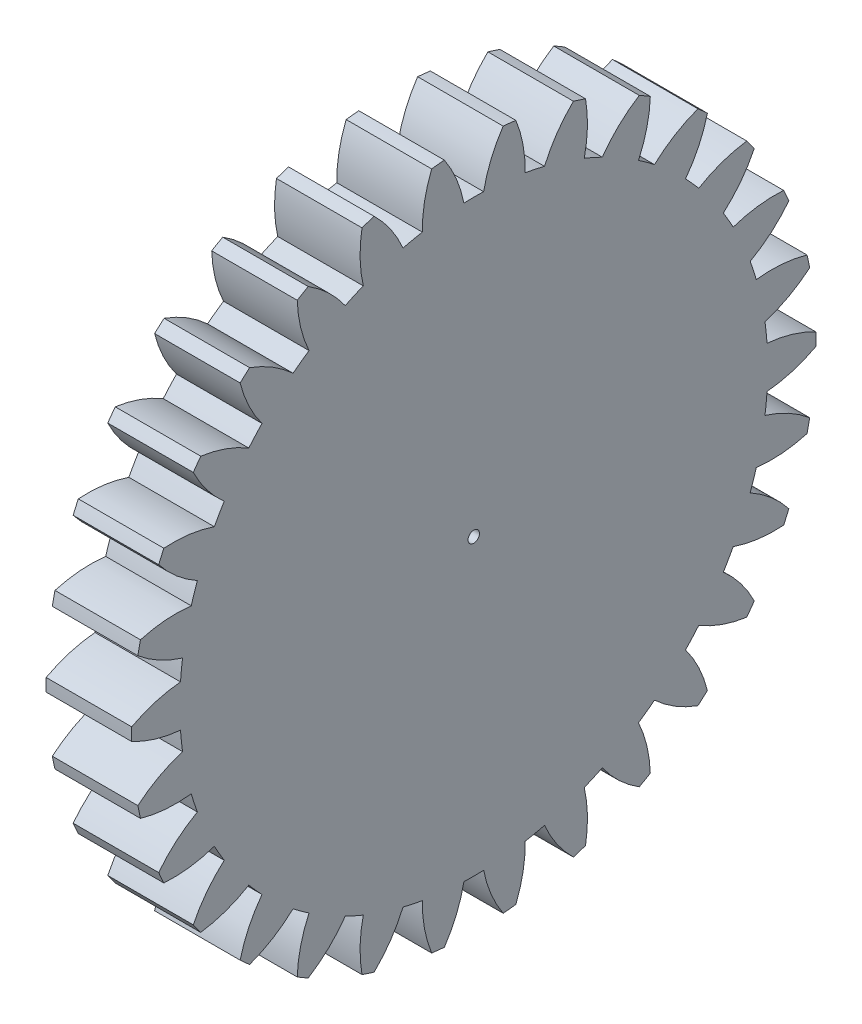
from build123d import *

# Parameters (mm, degrees)
BASPROSKE_W     = 6
BASPROSKE_H     = 24
TOOTHCUT_DEPTH  = 35.467375879
TEETHCUTS_COUNT = 30
TEETHCUTS_ANGLE = 348
BORSKE_R        = 0.4
BORE_DEPTH      = 50.0000508


with BuildPart() as part:
    # BasProSke → Base-Revolve (revolve)
    with BuildSketch(Plane(origin=(0, 0, 0), x_dir=(1, 0, 0), z_dir=(0, 1, 0))):
        with Locations((3, 12)):
            Rectangle(BASPROSKE_W, BASPROSKE_H)
    revolve(axis=Axis((-10, 0, 0), (1, 0, 0)))

    # TooCutSke → ToothCut (cut, through all)
    with BuildSketch(Plane(origin=(0, 0, 0), x_dir=(0, 0, -1), z_dir=(1, 0, 0))):
        with BuildLine():
            ThreePointArc((0.693278797, 20.612344372), (0, 20.624), (-0.693278797, 20.612344372))
            ThreePointArc((-0.693278797, 20.612344372), (-1.219042225, 22.34383125), (-2.080549663, 23.935144835))
            ThreePointArc((-2.080549663, 23.935144835), (0, 24.0254), (2.080549663, 23.935144835))
            ThreePointArc((2.080549663, 23.935144835), (1.219042225, 22.34383125), (0.693278797, 20.612344372))
        make_face()
    toothcut = extrude(amount=TOOTHCUT_DEPTH, mode=Mode.SUBTRACT)

    # TeethCuts: ToothCut ×30 about axis
    teethcuts_axis = Axis((-10, 0, 0), (1, 0, 0))
    for i in range(1, TEETHCUTS_COUNT):
        add(toothcut.rotate(teethcuts_axis, i * TEETHCUTS_ANGLE / (TEETHCUTS_COUNT - 1)), mode=Mode.SUBTRACT)

    # BorSke → Bore (cut, symmetric)
    with BuildSketch(Plane(origin=(0, 0, 0), x_dir=(0, 0, -1), z_dir=(1, 0, 0))):
        Circle(BORSKE_R)
    extrude(amount=BORE_DEPTH, both=True, mode=Mode.SUBTRACT)


solid = part.part
